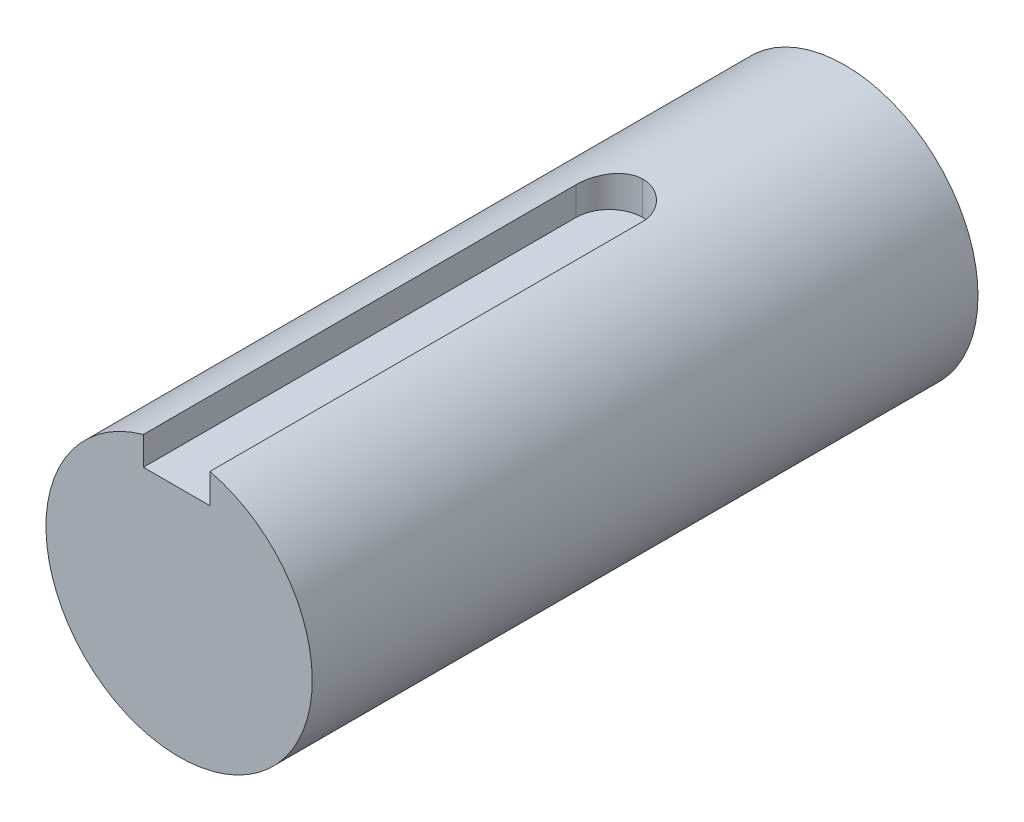
from build123d import *

# Parameters (mm, degrees)
SKETCH1_R           = 50
BOSS_EXTRUDE1_DEPTH = 250
SKETCH2_W           = 25
SKETCH2_H           = 25
CUT_EXTRUDE1_DEPTH  = 175
FILLET1_R           = 12.5
FILLET2_R           = 12.5


with BuildPart() as part:
    # Sketch1 → Boss-Extrude1 (new body)
    with BuildSketch(Plane.XY):
        Circle(SKETCH1_R)
    extrude(amount=BOSS_EXTRUDE1_DEPTH)

    # Sketch2 → Cut-Extrude1 (cut)
    with BuildSketch(Plane.XY.offset(250)):
        with Locations((-0.919686695, 49.991541048)):
            Rectangle(SKETCH2_W, SKETCH2_H)
    extrude(amount=-CUT_EXTRUDE1_DEPTH, mode=Mode.SUBTRACT)

    # Fillet1
    fillet1_edges = [part.edges().sort_by_distance(p)[0] for p in [
        (-13.419686695, 42.828502974, 75),
    ]]
    fillet(fillet1_edges, radius=FILLET1_R)

    # Fillet2
    fillet2_edges = [part.edges().sort_by_distance(p)[0] for p in [
        (11.580313305, 43.066010777, 75),
    ]]
    fillet(fillet2_edges, radius=FILLET2_R - 0.0001)  # a hair under: the kernel refuses the full size


solid = part.part
